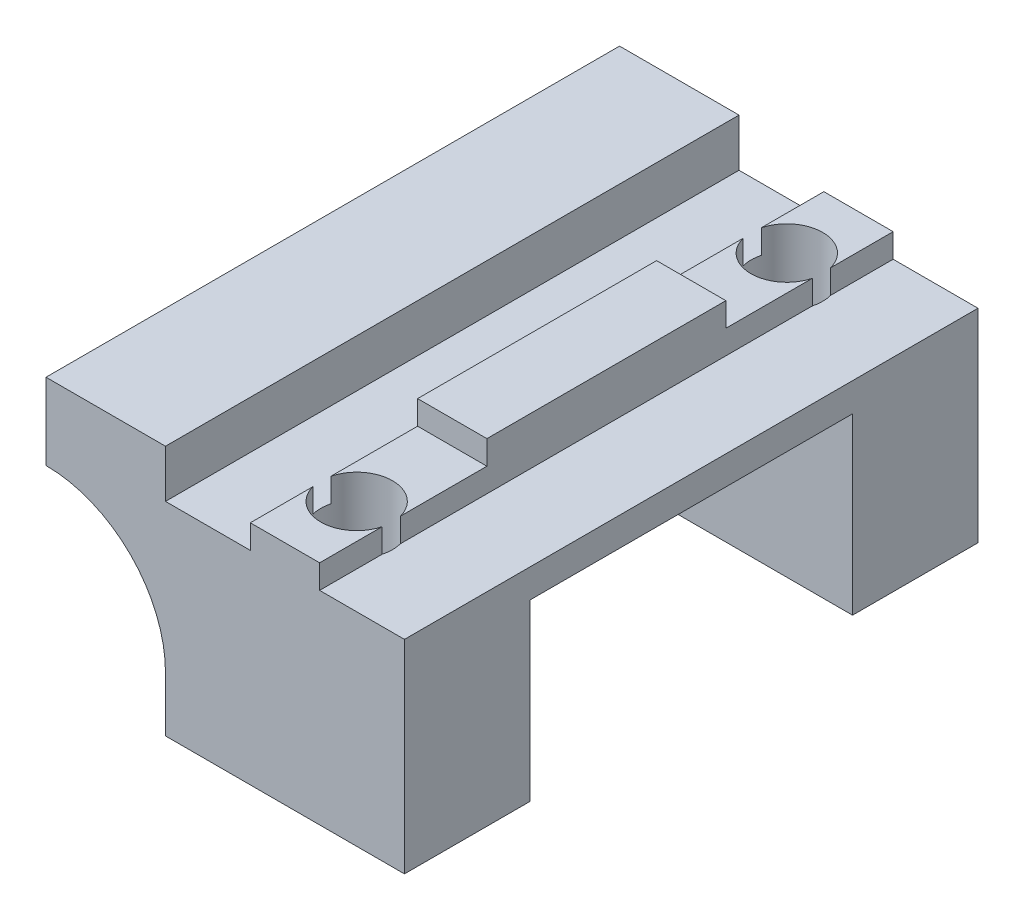
from build123d import *

# Parameters (mm, degrees)
MAIN_DEPTH                      = 12
SKETCH2_R                       = 1.5
HOLEMAKERBEAMFIX_DEPTH          = 17.710774967
SKETCH3_W                       = 10
SKETCH3_H                       = 13.5
MAINCONNECTORHOLE_DEPTH         = 7.3
SKETCH4_W                       = 5
SKETCH4_H                       = 24
CONNECTORSUPPORTEXTENSION_DEPTH = 3.2
SKETCH5_W                       = 1.8
SKETCH5_H                       = 8.5
CONNECTORRAILHOLE_DEPTH         = 1.5
SKETCH6_W                       = 2.9
SKETCH6_H                       = 7
CUT_EXTRUDE4_DEPTH              = 1
FILLET3_R                       = 5


with BuildPart() as part:
    # Sketch1 → Main (new, symmetric)
    with BuildSketch(Plane.XY):
        Polygon((-5, 8.5), (-5, 0), (5, 0), (5, 8.5), (1.45, 8.5), (1.45, 10.5), (-1.45, 10.5), (-1.45, 8.5), align=None)
    extrude(amount=MAIN_DEPTH, both=True)

    # Sketch2 → HoleMakerBeamFix (cut, through all)
    with BuildSketch(Plane(origin=(0, 10.5, 0), x_dir=(1, 0, 0), z_dir=(0, 1, 0))):
        with Locations(Location((0, -9, 0), (0, 0, 270))):
            Circle(SKETCH2_R)
        with Locations(Location((0, 9, 0), (0, 0, 270))):
            Circle(SKETCH2_R)
    extrude(amount=-HOLEMAKERBEAMFIX_DEPTH, mode=Mode.SUBTRACT)

    # Sketch3 → MainConnectorHole (cut)
    with BuildSketch(Plane(origin=(0, 0, 0), x_dir=(-1, 0, 0), z_dir=(0, -1, 0))):
        Rectangle(SKETCH3_W, SKETCH3_H)
    extrude(amount=-MAINCONNECTORHOLE_DEPTH, mode=Mode.SUBTRACT)

    # Sketch4 → ConnectorSupportExtension (add)
    with BuildSketch(Plane(origin=(0, 7.3, 0), x_dir=(-1, 0, 0), z_dir=(0, -1, 0))):
        with Locations((7.5, 0)):
            Rectangle(SKETCH4_W, SKETCH4_H)
    extrude(amount=-CONNECTORSUPPORTEXTENSION_DEPTH)

    # Sketch5 → ConnectorRailHole (cut)
    with BuildSketch(Plane(origin=(0, 7.3, 0), x_dir=(-1, 0, 0), z_dir=(0, -1, 0))):
        with Locations((7.9, 0)):
            Rectangle(SKETCH5_W, SKETCH5_H)
    extrude(amount=-CONNECTORRAILHOLE_DEPTH, mode=Mode.SUBTRACT)

    # Sketch6 → Cut-Extrude4 (cut)
    with BuildSketch(Plane(origin=(0, 10.5, 0), x_dir=(1, 0, 0), z_dir=(0, 1, 0))):
        with Locations((0, 8.5)):
            Rectangle(SKETCH6_W, SKETCH6_H)
        with Locations((0, -8.5)):
            Rectangle(SKETCH6_W, SKETCH6_H)
    extrude(amount=-CUT_EXTRUDE4_DEPTH, mode=Mode.SUBTRACT)

    # Fillet3
    fillet3_edges = [part.edges().sort_by_distance(p)[0] for p in [
        (-5, 7.3, -9.375),
        (-5, 7.3, 9.375),
    ]]
    fillet(fillet3_edges, radius=FILLET3_R - 0.0001)  # a hair under: the kernel refuses the full size


solid = part.part
